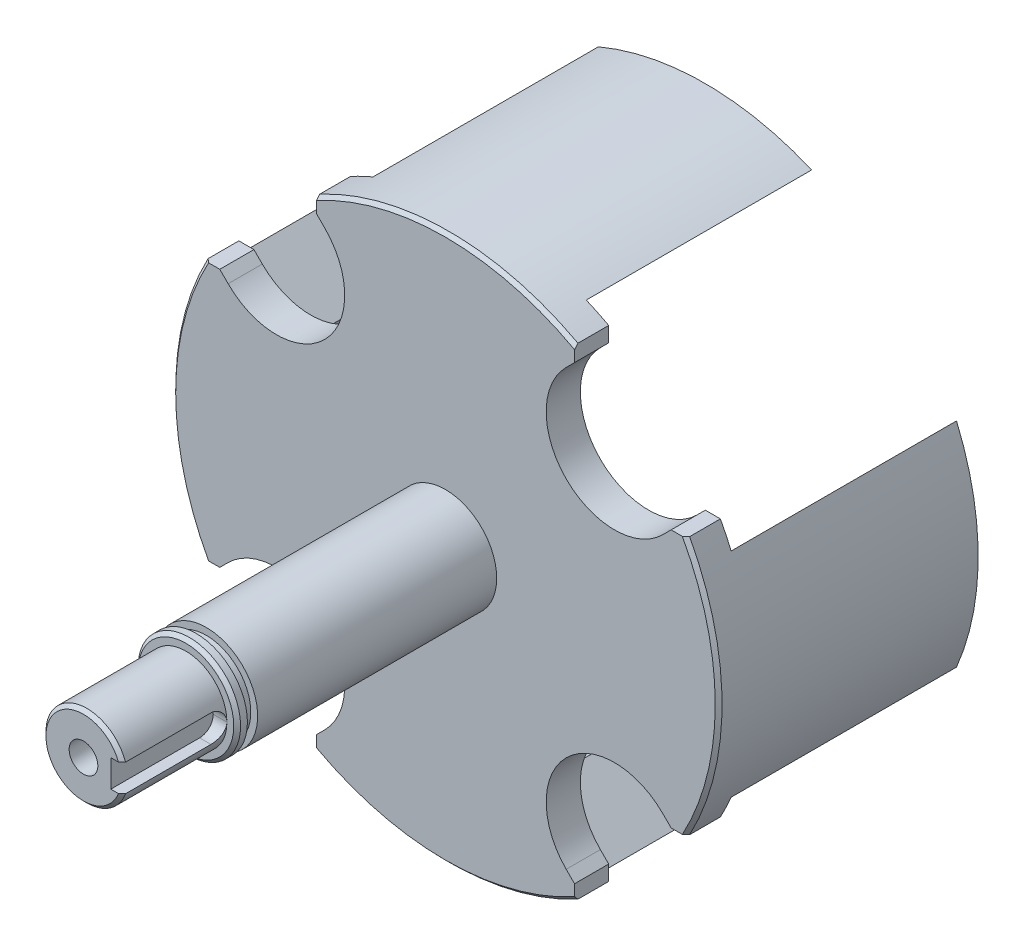
from build123d import *
from build123d.topology import SkipClean

# Parameters (mm, degrees)
SKETCH_1_R               = 40
EXTRUDE_1_DEPTH          = 5
SKETCH_2_R               = 7.5
EXTRUDE_2_DEPTH          = 38
SKETCH_3_W               = 1.5
SKETCH_3_H               = 4.460741585
SKETCH_4_R               = 6
EXTRUDE_3_DEPTH          = 15
CHAMFER_1_SIZE           = 0.5
SKETCH_5_W               = 7.892485333
SKETCH_5_H               = 4
CUT_EXTRUDE_1_DEPTH      = 15
FILLET_1_R               = 2
EXTRUDE_START            = 33
SKETCH_6_R               = 40
SKETCH_6_R_2             = 30
EXTRUDE_4_DEPTH          = 33
PATTERN_CIRCULAR_1_COUNT = 4
CUT_EXTRUDE_2_DEPTH      = 33
PATTERN_CIRCULAR_2_COUNT = 2
PATTERN_CIRCULAR_2_ANGLE = 90
SKETCH_12_R              = 8.5
CUT_EXTRUDE_3_DEPTH      = 2
HOLE_WIZARD_M6_1_D       = 5
HOLE_WIZARD_M6_1_DEPTH   = 15
HOLE_WIZARD_M6_1_TIP     = 1.502151548
CUT_EXTRUDE_4_DEPTH      = 10
PATTERN_CIRCULAR_3_COUNT = 4
CHAMFER_2_SIZE           = 2
HOLE_WIZARD_M5_1_D       = 4.2
HOLE_WIZARD_M5_1_DEPTH   = 12.4
HOLE_WIZARD_M5_1_TIP     = 1.2618073


# Some blends are built 0.0001 mm under size
with BuildPart() as part:
    # 草图1 → 凸台-拉伸1 (new body)
    with BuildSketch(Plane.XY):
        with Locations((-62.277052722, 0)):
            Circle(SKETCH_1_R)
    extrude(amount=EXTRUDE_1_DEPTH)

    # 草图2 → 凸台-拉伸2 (add)
    with BuildSketch(Plane.XY.offset(5)):
        with Locations((-62.277052722, 0)):
            Circle(SKETCH_2_R)
    extrude(amount=EXTRUDE_2_DEPTH)

    # 草图3 → 切除-旋转1 (revolve, cut)
    with BuildSketch(Plane(origin=(0, 0, 0), x_dir=(0, 0, -1), z_dir=(0, -1, 0)), mode=Mode.PRIVATE) as cut_revolve_1_sk:
        with Locations((-40.75, -53.54668193)):
            Rectangle(SKETCH_3_W, SKETCH_3_H)
    revolve(cut_revolve_1_sk.sketch.rotate(Axis((-62.277052722, 0, 23.170133407), (0, 0, 1)), 180), axis=Axis((-62.277052722, 0, 23.170133407), (0, 0, 1)), mode=Mode.SUBTRACT)

    # 草图4 → 凸台-拉伸3 (add)
    with BuildSketch(Plane.XY.offset(43)):
        with Locations((-62.277052722, 0)):
            Circle(SKETCH_4_R)
    extrude(amount=EXTRUDE_3_DEPTH)

    # 倒角1
    chamfer_1_edges = [part.edges().sort_by_distance(p)[0] for p in [
        (-68.277052722, 0, 58),
        (-102.277052722, 0, 5),
        (-69.777052722, 0, 43),
    ]]
    chamfer(chamfer_1_edges, length=CHAMFER_1_SIZE)

    # 草图5 → 切除-拉伸1 (cut)
    with BuildSketch(Plane.XY.offset(58)):
        with Locations((-54.330810056, 0)):
            Rectangle(SKETCH_5_W, SKETCH_5_H)
    extrude(amount=-CUT_EXTRUDE_1_DEPTH, mode=Mode.SUBTRACT)

    # 圆角1
    fillet_1_edges = [part.edges().sort_by_distance(p)[0] for p in [
        (-57.448625597, -2, 43),
        (-57.448625597, 2, 43),
    ]]
    fillet(fillet_1_edges, radius=FILLET_1_R - 0.0001)  # a hair under: the kernel refuses the full size

    # 草图6 → 凸台-拉伸4 (add)
    with SkipClean():  # the faces are left unmerged after this step: merging them gives an invalid solid
        with BuildSketch(Plane(origin=(0, 0, 0), x_dir=(-1, 0, 0), z_dir=(0, 0, -1)).offset(EXTRUDE_START)):
            with Locations((62.277052722, 0)):
                Circle(SKETCH_6_R)
            with Locations((62.277052722, 0)):
                Circle(SKETCH_6_R_2, mode=Mode.SUBTRACT)
        extrude(amount=-EXTRUDE_4_DEPTH)

    # 草图9 → M8 螺纹孔1 (revolve, cut)
    with SkipClean():  # the faces are left unmerged after this step: merging them gives an invalid solid
        with BuildSketch(Plane(origin=(-97.277052722, 0, -33), x_dir=(0, 1, 0), z_dir=(1, 0, 0))):
            Polygon((0, 0), (0, 21.792926105), (3.4, 19.75), (3.4, 0), align=None)
        hole_wizard_m8_1 = revolve(axis=Axis((-97.277052722, 0, -39.35), (0, 0, 1)), mode=Mode.SUBTRACT)

    # 阵列(圆周)1: M8 螺纹孔1 ×4 about axis
    with SkipClean():  # the faces are left unmerged after this step: merging them gives an invalid solid
        pattern_circular_1_axis = Axis((-62.277052722, 0, 0), (0, 0, 1))
        for i in range(1, PATTERN_CIRCULAR_1_COUNT):
            add(hole_wizard_m8_1.rotate(pattern_circular_1_axis, i * 360 / PATTERN_CIRCULAR_1_COUNT), mode=Mode.SUBTRACT)

    # 草图11 → 切除-拉伸2 (cut)
    with SkipClean():  # the faces are left unmerged after this step: merging them gives an invalid solid
        with BuildSketch(Plane(origin=(0, 0, -33), x_dir=(-1, 0, 0), z_dir=(0, 0, -1))):
            Polygon((-32.267123115, 73.330972402), (135.608025124, -94.544175837), (156.82122856, -73.330972402), (-11.05391968, 94.544175837), align=None)
        cut_extrude_2 = extrude(amount=-CUT_EXTRUDE_2_DEPTH, mode=Mode.SUBTRACT)
    add(part.part.scale(1), mode=Mode.REPLACE)  # the faces are merged on a copy

    # 阵列(圆周)2: 切除-拉伸2 ×2 about axis
    pattern_circular_2_axis = Axis((-62.277052722, 0, -33), (0, 0, 1))
    for i in range(1, PATTERN_CIRCULAR_2_COUNT):
        add(cut_extrude_2.rotate(pattern_circular_2_axis, i * PATTERN_CIRCULAR_2_ANGLE / (PATTERN_CIRCULAR_2_COUNT - 1)), mode=Mode.SUBTRACT)

    # 草图12 → 切除-拉伸3 (cut)
    with BuildSketch(Plane(origin=(0, 0, 0), x_dir=(-1, 0, 0), z_dir=(0, 0, -1))):
        with Locations((62.277052722, 0)):
            Circle(SKETCH_12_R)
    extrude(amount=-CUT_EXTRUDE_3_DEPTH, mode=Mode.SUBTRACT)

    # M6 螺纹孔1
    with Locations(Plane(origin=(0, 0, 2), x_dir=(-1, 0, 0), z_dir=(0, 0, -1))):
        with Locations((62.277052722, 0)):
            Hole(HOLE_WIZARD_M6_1_D / 2, depth=HOLE_WIZARD_M6_1_DEPTH)
            with Locations((0, 0, -(HOLE_WIZARD_M6_1_DEPTH + HOLE_WIZARD_M6_1_TIP / 2))):  # 118° drill point
                Cone(0, HOLE_WIZARD_M6_1_D / 2, HOLE_WIZARD_M6_1_TIP, mode=Mode.SUBTRACT)

    # 草图15 → 切除-拉伸4 (cut)
    with BuildSketch(Plane(origin=(0, 0, 0), x_dir=(-1, 0, 0), z_dir=(0, 0, -1))):
        with BuildLine():
            Line((79.954722252, 31.819805153), (83.490256158, 35.355339059))
            ThreePointArc((83.490256158, 35.355339059), (97.632391781, 35.355339059), (97.632391781, 21.213203436))
            Line((97.632391781, 21.213203436), (94.096857875, 17.67766953))
            ThreePointArc((94.096857875, 17.67766953), (79.954722252, 17.67766953), (79.954722252, 31.819805153))
        make_face()
    cut_extrude_4 = extrude(amount=-CUT_EXTRUDE_4_DEPTH, mode=Mode.SUBTRACT)

    # 阵列(圆周)3: 切除-拉伸4 ×4 about axis
    pattern_circular_3_axis = Axis((-62.277052722, 0, 0), (0, 0, 1))
    for i in range(1, PATTERN_CIRCULAR_3_COUNT):
        add(cut_extrude_4.rotate(pattern_circular_3_axis, i * 360 / PATTERN_CIRCULAR_3_COUNT), mode=Mode.SUBTRACT)

    # 倒角2
    # the kernel refuses this chamfer: 2, 1.641704769 mm, written as the material it takes off along each edge
    with BuildSketch(Plane(origin=(-41.961992659, -34.457195687, 9.643365976), x_dir=(-0.8715539040567665, -0.4902996964341389, 0), z_dir=(0, 0, -1)), Plane(origin=(-27.819857035, 20.315060063, 9.643365976), x_dir=(0.49029969643413934, -0.8715539040567662, 0), z_dir=(0, 0, -1)), Plane(origin=(-82.592112785, 34.457195687, 9.643365976), x_dir=(0.8715539040567699, 0.4902996964341327, 0), z_dir=(0, 0, -1)), Plane(origin=(-96.734248409, -20.315060063, 9.643365976), x_dir=(-0.4902996964341341, 0.8715539040567691, 0), z_dir=(0, 0, -1))) as chamfer_2_piece_1:
        with BuildLine():
            Line((1.622634648, 0), (CHAMFER_2_SIZE * 0.269587435566, CHAMFER_2_SIZE * 0.96297591589))
            Line((CHAMFER_2_SIZE * 0.269587435566, CHAMFER_2_SIZE * 0.96297591589), (0, 0))
            ThreePointArc((0, 0), (0.83091626, -0.008223992), (1.622634648, 0))
        make_face()
    extrude(amount=14.786731952, mode=Mode.SUBTRACT)
    with BuildSketch(Plane(origin=(-27.819857035, -20.315060063, 9.643365976), x_dir=(0.49029969643413596, 0.871553904056768, 0), z_dir=(0, 0, -1)), Plane(origin=(-41.961992659, 34.457195687, 9.643365976), x_dir=(-0.8715539040567644, 0.4902996964341427, 0), z_dir=(0, 0, -1)), Plane(origin=(-96.734248409, 20.315060063, 9.643365976), x_dir=(-0.49029969643413984, -0.8715539040567659, 0), z_dir=(0, 0, -1)), Plane(origin=(-82.592112785, -34.457195687, 9.643365976), x_dir=(0.8715539040567665, -0.4902996964341389, 0), z_dir=(0, 0, -1))) as chamfer_2_piece_2:
        with BuildLine():
            Line((1.622634648, 0), (CHAMFER_2_SIZE * 0.269587435566, -CHAMFER_2_SIZE * 0.96297591589))
            Line((CHAMFER_2_SIZE * 0.269587435566, -CHAMFER_2_SIZE * 0.96297591589), (0, 0))
            ThreePointArc((0, 0), (0.83091626, 0.008223992), (1.622634648, 0))
        make_face()
    extrude(amount=14.786731952, mode=Mode.SUBTRACT)

    # M5 螺纹孔1
    with Locations(Plane.XY.offset(58)):
        with Locations((-62.277052722, 0)):
            Hole(HOLE_WIZARD_M5_1_D / 2, depth=HOLE_WIZARD_M5_1_DEPTH)
            with Locations((0, 0, -(HOLE_WIZARD_M5_1_DEPTH + HOLE_WIZARD_M5_1_TIP / 2))):  # 118° drill point
                Cone(0, HOLE_WIZARD_M5_1_D / 2, HOLE_WIZARD_M5_1_TIP, mode=Mode.SUBTRACT)


solid = part.part
